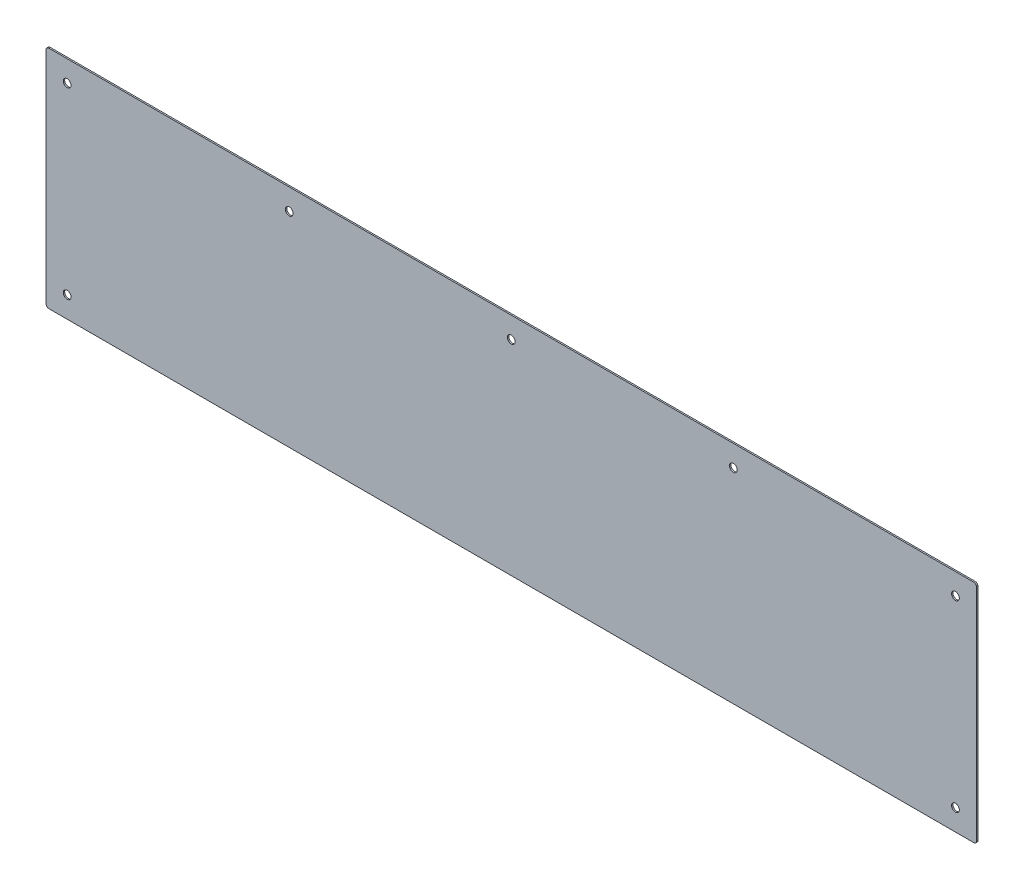
from build123d import *

# Parameters (mm, degrees)
SKETCH1_W            = 660
SKETCH1_H            = 160
BASE_FLANGE1_DEPTH   = 1
M5_CLEARANCE_HOLE2_D = 5.5
FILLET1_R            = 2


# Sheet-metal steps are written as plain solids
with BuildPart() as part:
    # Sketch1 → Base-Flange1 (new body)
    with BuildSketch(Plane.XY):
        Rectangle(SKETCH1_W, SKETCH1_H)
    extrude(amount=-BASE_FLANGE1_DEPTH)

    # M5 Clearance Hole2 (through all)
    with Locations(Plane.XY):
        with Locations((0, 65), (-315, 65), (-315, -65), (315, -65), (315, 65), (-157.5, 65), (157.5, 65)):
            Hole(M5_CLEARANCE_HOLE2_D / 2)

    # Fillet1
    fillet1_edges = [part.edges().sort_by_distance(p)[0] for p in [
        (-330, 80, -0.5),
        (330, 80, -0.5),
        (330, -80, -0.5),
        (-330, -80, -0.5),
    ]]
    fillet(fillet1_edges, radius=FILLET1_R)


solid = part.part
